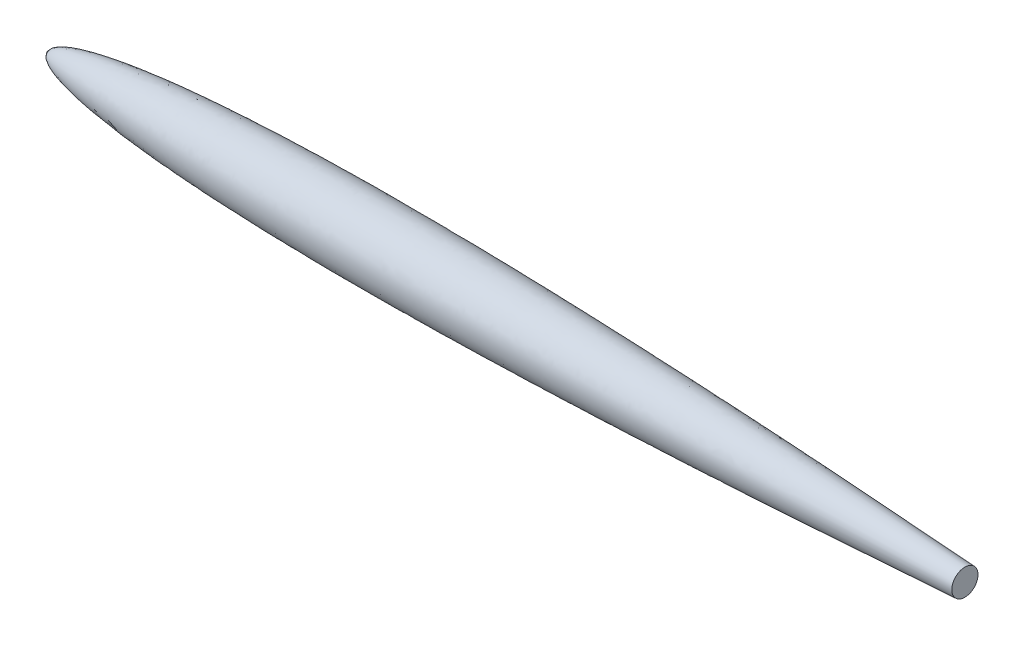
from build123d import *

# Parameters (mm, degrees)
CUTSKETCH_R        = 274.5
CUT_EXTRUDE1_DEPTH = 7514.038347953


with BuildPart() as part:
    # rootSketch → Revolve1 (revolve)
    with BuildSketch(Plane(origin=(0, 0, 0), x_dir=(1, 0, 0), z_dir=(0, 1, 0))):
        with BuildLine():
            Line((0, 0), (9150, 0))
            add(Edge.make_bspline(
                [(0, 0), (0.000160612, 1.178338668), (0.101927429, 3.527546875), (0.560540129, 7.032762128), (1.754850899, 11.594263448), (3.435425658, 15.899983247), (5.499066319, 19.933959303), (8.311039095, 24.428945776), (11.485219555, 28.590828066), (14.976932189, 32.50948125), (19.969099058, 37.44219556), (26.93755643, 43.450361558), (36.087640326, 50.070782057), (47.476912242, 57.077759188), (61.540387156, 64.652473124), (77.183799538, 72.071636941), (94.792158043, 79.45256662), (114.338032981, 86.767844958), (138.330950586, 94.94042848), (167.437529655, 103.839028072), (202.19021179, 113.297577183), (242.618908211, 123.079119609), (283.85237063, 132.074401946), (324.914851639, 140.247080301), (365.766389078, 147.738368505), (416.451146253, 156.365751208), (477.022127198, 165.766869274), (547.845629726, 175.668869941), (630.588182863, 186.00110632), (715.101408629, 195.473660488), (801.36280682, 204.181856395), (889.35557409, 212.199179233), (977.413477894, 219.463094498), (1065.523951613, 226.056192188), (1153.677402277, 232.045348732), (1241.866295097, 237.485951633), (1352.184475076, 243.661385297), (1484.651724521, 250.147610485), (1639.281632973, 256.512937248), (1816.080414931, 262.344959236), (1992.916414639, 266.897490578), (2169.777939711, 270.304082119), (2346.656177774, 272.675700655), (2523.544368397, 274.106433958), (2744.66055408, 274.819477986), (3010.001312139, 274.095543923), (3319.553789887, 271.216223434), (3673.296781268, 265.523933355), (4026.999477835, 257.744990519), (4380.656831985, 248.137527842), (4734.266305229, 236.914341825), (5087.826900398, 224.250429382), (5441.338456238, 210.288408279), (5794.801148288, 195.142305772), (6148.215104246, 178.900408204), (6501.580112325, 161.627361411), (6810.730974752, 145.648489217), (7075.685369906, 131.348153783), (7296.458530996, 119.029096191), (7473.063386989, 108.931656651), (7649.654093753, 98.589922493), (7826.230154186, 88.000635748), (7980.720793582, 78.514563511), (8113.131405924, 70.222733955), (8223.466573069, 63.20354654), (8311.730622771, 57.521688204), (8399.989953528, 51.772397348), (8488.245445279, 45.954572173), (8565.463885668, 40.803168085), (8631.649893589, 36.343336289), (8686.800104424, 32.597150054), (8730.924004516, 29.58176595), (8775.036611273, 26.548875536), (8819.165790844, 23.496286414), (8863.263373244, 20.427327998), (8907.410710771, 17.335912578), (8951.468898618, 14.231955542), (8990.160782109, 11.488944565), (9023.096897261, 9.142268217), (9050.904900655, 7.152311591), (9072.498802607, 5.602858669), (9095.442400122, 3.95038404), (9115.835188706, 2.478332147), (9134.825858835, 1.101944003), (9144.986407858, 0.364362809), (9150, 0)],
                knots=[0, 0, 0, 0, 0, 0.000464454, 0.000928907, 0.001393361, 0.001857814, 0.002287128, 0.002716441, 0.003486019, 0.003922473, 0.004358926, 0.005488094, 0.007117503, 0.008377929, 0.009638355, 0.011796648, 0.013954941, 0.015918589, 0.017882237, 0.021809533, 0.025977713, 0.030145893, 0.034314073, 0.038482253, 0.042518279, 0.046554305, 0.054626357, 0.062698409, 0.070770462, 0.079497478, 0.088224494, 0.09695151, 0.105678526, 0.114405542, 0.123132558, 0.131859574, 0.14058659, 0.158058513, 0.175530436, 0.193002359, 0.210474282, 0.227946206, 0.24541813, 0.262890054, 0.280361977, 0.315305825, 0.350249672, 0.38519352, 0.420137368, 0.455081215, 0.490025063, 0.524968911, 0.559912758, 0.594856606, 0.629800453, 0.664744301, 0.699688149, 0.717160073, 0.734631996, 0.75210392, 0.769575844, 0.787047768, 0.804519691, 0.813255653, 0.821991615, 0.830727577, 0.839463539, 0.848199501, 0.856935463, 0.861303444, 0.865671425, 0.870039406, 0.874407387, 0.878775368, 0.883143349, 0.88751133, 0.891879311, 0.896247292, 0.898431282, 0.900615273, 0.902799263, 0.904983254, 0.907167244, 0.909351235, 0.909351235, 0.909351235, 0.909351235, 0.909351235], degree=4))
        make_face()
    revolve(axis=Axis((0, 0, 0), (1, 0, 0)))

    # cutSketch → Cut-Extrude1 (cut, through all)
    with BuildSketch(Plane(origin=(7503, 0, 0), x_dir=(0, 0, -1), z_dir=(1, 0, 0))):
        Circle(CUTSKETCH_R)
    extrude(amount=CUT_EXTRUDE1_DEPTH, mode=Mode.SUBTRACT)


solid = part.part
